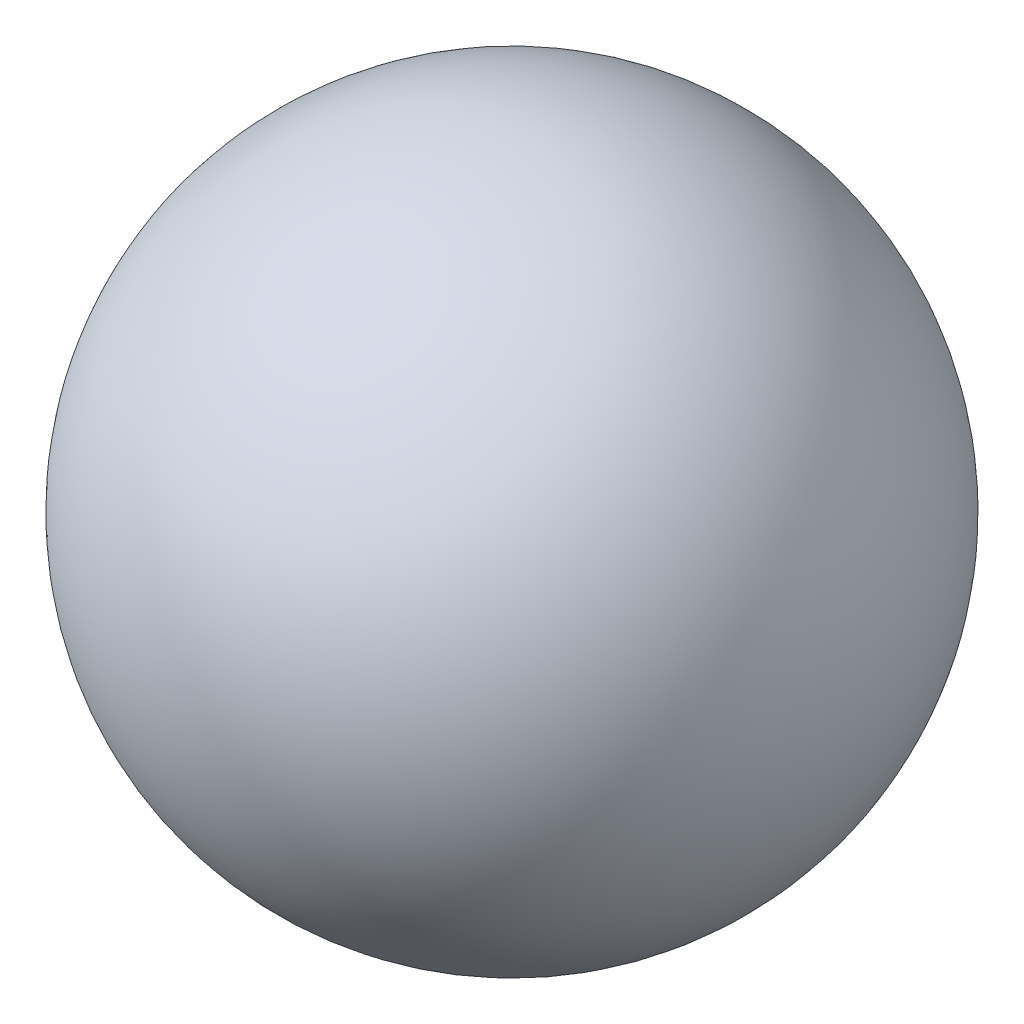
from build123d import *


with BuildPart() as part:
    # Sketch1 → Revolve1 (revolve)
    with BuildSketch(Plane(origin=(0, 76.75, 0), x_dir=(-1, 0, 0), z_dir=(0, -1, 0))):
        with BuildLine():
            Line((-13.5, -0.25), (7, -0.25))
            ThreePointArc((7, -0.25), (-3.25, -10.5), (-13.5, -0.25))
        make_face()
    revolve(axis=Axis((13.5, 76.75, 0.25), (-1, 0, 0)))


solid = part.part
